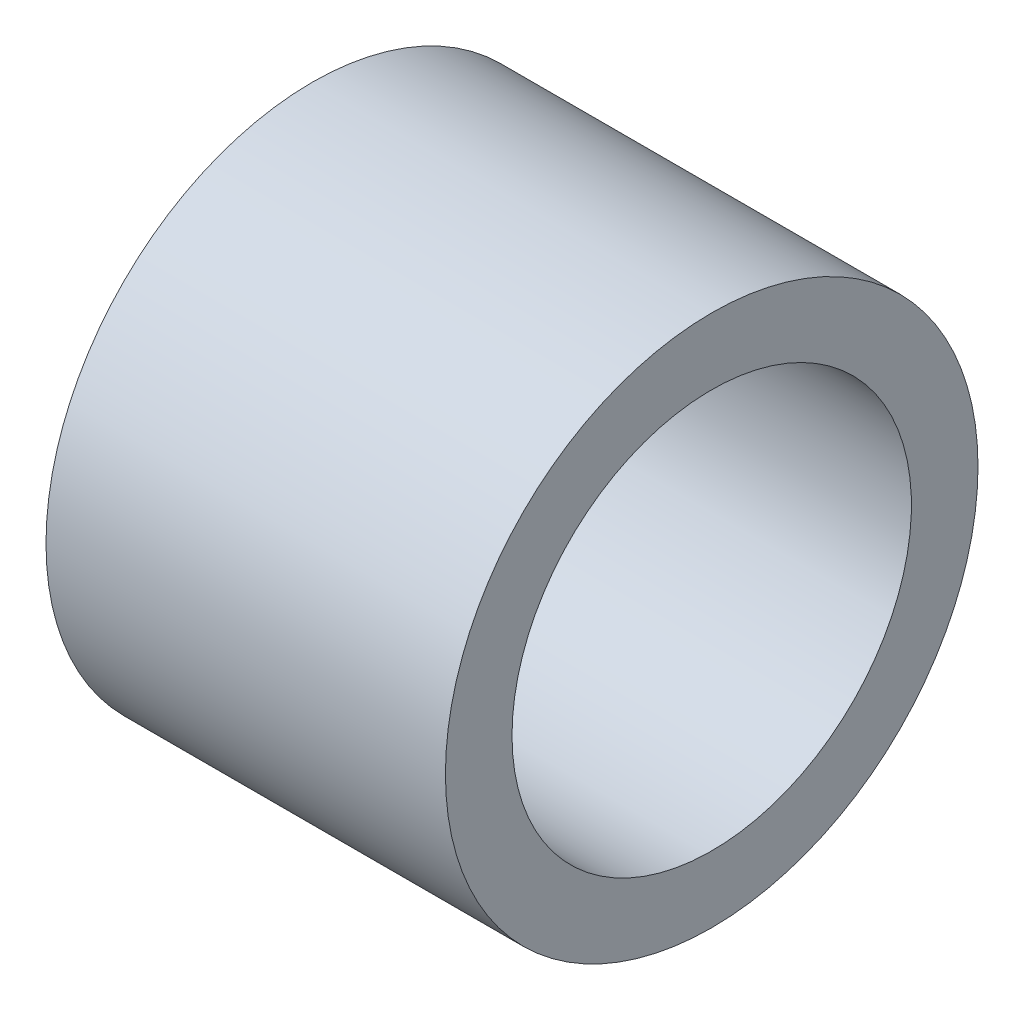
from build123d import *

# Parameters (mm, degrees)
SKETCH1_W = 6
SKETCH1_H = 1


with BuildPart() as part:
    # Sketch1 → Revolve1 (revolve)
    with BuildSketch(Plane.XY):
        with Locations((3, 3.5)):
            Rectangle(SKETCH1_W, SKETCH1_H)
    revolve(axis=Axis((0, 0, 0), (1, 0, 0)))


solid = part.part
